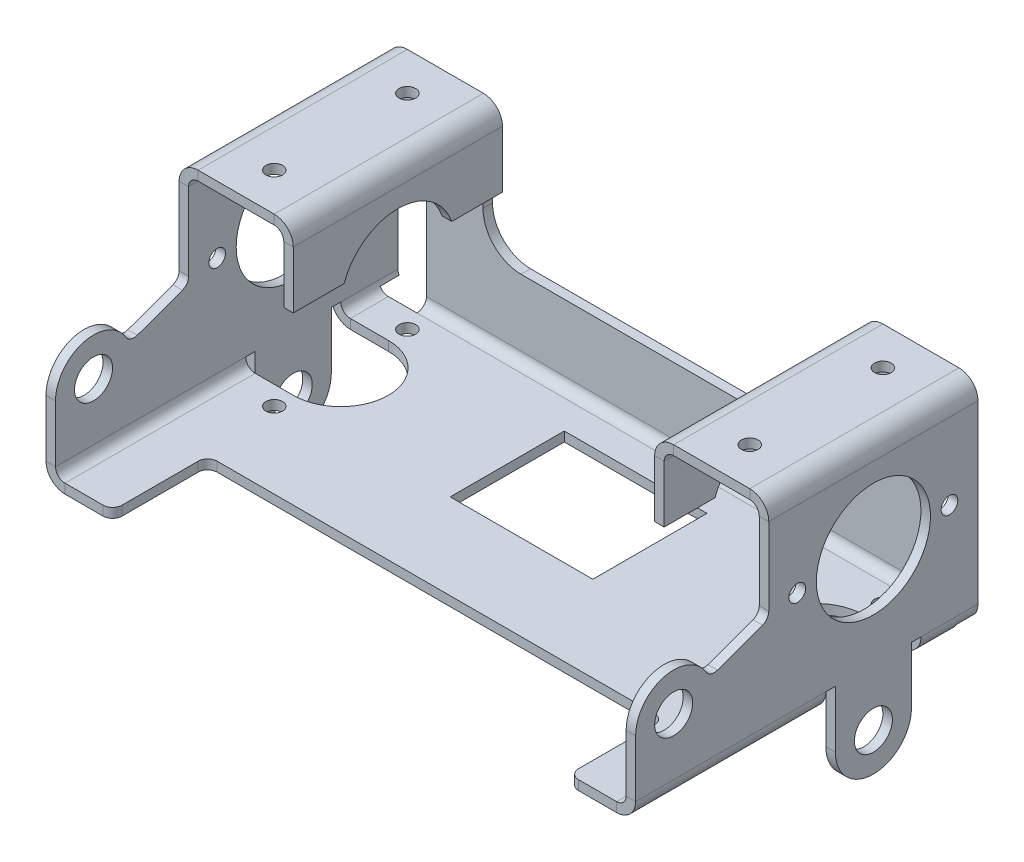
from build123d import *

# Parameters (mm, degrees)
BASE_FLANGE1_DEPTH           = 36
SKETCH6_W                    = 96
SKETCH6_H                    = 20
CUT_EXTRUDE1_DEPTH           = 10
BREAK_CORNER1_DEPTH          = 2
BREAK_CORNER1_2_DEPTH        = 2
SKETCH10_R                   = 4
CUT_EXTRUDE3_DEPTH           = 137.736973785
SKETCH11_W                   = 28
SKETCH11_H                   = 4
CUT_EXTRUDE4_DEPTH           = 137.736973785
SKETCH12_R                   = 12
SKETCH12_R_2                 = 1.75
CUT_EXTRUDE5_DEPTH           = 137.736973785
SKETCH13_W                   = 30
SKETCH13_H                   = 24
CUT_EXTRUDE6_DEPTH           = 84.600239234
CUT_EXTRUDE7_START           = -84.600239234
SKETCH17_W                   = 4
SKETCH17_H                   = 2
SKETCH17_H_2                 = 16
CUT_EXTRUDE7_DEPTH           = 86.600239234
SKETCH24_R                   = 4
TAB1_DEPTH                   = 2
CUT_EXTRUDE9_START           = -36
CUT_EXTRUDE9_DEPTH           = 4
EDGE_FLANGE2_STRIP_W         = 12
EDGE_FLANGE2_STRIP_H         = 2
EDGE_FLANGE2_STRIP_CUT_DEPTH = 106
EDGE_FLANGE2_DEPTH           = 106
EDGE_FLANGE2_FLAT_DEPTH      = 2
SKETCH39_R                   = 1.75
CUT_EXTRUDE10_DEPTH          = 95.132884796


# Read off the part's stored shape, not the designer's step: Break-Corner1, Cut-Extrude9
# Sheet-metal steps are written as plain solids
with BuildPart() as part:
    # Sketch1 → Base-Flange1 (new, symmetric)
    with BuildSketch(Plane.XY):
        with BuildLine():
            Line((-38, 29), (-38, 41))
            ThreePointArc((-38, 41), (-39.171572875, 43.828427125), (-42, 45))
            Line((-42, 45), (-58, 45))
            ThreePointArc((-58, 45), (-60.828427125, 43.828427125), (-62, 41))
            Line((-62, 41), (-62, 4))
            ThreePointArc((-62, 4), (-60.828427125, 1.171572875), (-58, 0))
            Line((-58, 0), (58, 0))
            ThreePointArc((58, 0), (60.828427125, 1.171572875), (62, 4))
            Line((62, 4), (62, 41))
            ThreePointArc((62, 41), (60.828427125, 43.828427125), (58, 45))
            Line((58, 45), (42, 45))
            ThreePointArc((42, 45), (39.171572875, 43.828427125), (38, 41))
            Line((38, 41), (38, 29))
            Line((38, 29), (40, 29))
            Line((40, 29), (40, 41))
            ThreePointArc((40, 41), (40.585786438, 42.414213562), (42, 43))
            Line((42, 43), (58, 43))
            ThreePointArc((58, 43), (59.414213562, 42.414213562), (60, 41))
            Line((60, 41), (60, 4))
            ThreePointArc((60, 4), (59.414213562, 2.585786438), (58, 2))
            Line((58, 2), (-58, 2))
            ThreePointArc((-58, 2), (-59.414213562, 2.585786438), (-60, 4))
            Line((-60, 4), (-60, 41))
            ThreePointArc((-60, 41), (-59.414213562, 42.414213562), (-58, 43))
            Line((-58, 43), (-42, 43))
            ThreePointArc((-42, 43), (-40.585786438, 42.414213562), (-40, 41))
            Line((-40, 41), (-40, 29))
            Line((-40, 29), (-38, 29))
        make_face()
    extrude(amount=BASE_FLANGE1_DEPTH, both=True)

    # Sketch6 → Cut-Extrude1 (cut)
    with BuildSketch(Plane(origin=(0, 2, 0), x_dir=(1, 0, 0), z_dir=(0, 1, 0))):
        with Locations((0, -26)):
            Rectangle(SKETCH6_W, SKETCH6_H)
    extrude(amount=-CUT_EXTRUDE1_DEPTH, mode=Mode.SUBTRACT)

    # Break-Corner1 outline → Break-Corner1 (cut)
    with BuildSketch(Plane(origin=(0, 0, 0), x_dir=(1, 0, 0), z_dir=(0, 1, 0))):
        with BuildLine():
            Line((-48, -36), (-48, -34))
            ThreePointArc((-48, -34), (-48.585786438, -35.414213562), (-50, -36))
            Line((-50, -36), (-48, -36))
        make_face()
        with BuildLine():
            ThreePointArc((50, -36), (48.585786438, -35.414213562), (48, -34))
            Line((48, -34), (48, -36))
            Line((48, -36), (50, -36))
        make_face()
    extrude(amount=BREAK_CORNER1_DEPTH, mode=Mode.SUBTRACT)

    # Break-Corner1 2 outline → Break-Corner1 2 (add)
    with BuildSketch(Plane(origin=(0, 0, 0), x_dir=(1, 0, 0), z_dir=(0, 1, 0))):
        with BuildLine():
            Line((48, -16), (46, -16))
            ThreePointArc((46, -16), (47.414213562, -16.585786438), (48, -18))
            Line((48, -18), (48, -16))
        make_face()
        with BuildLine():
            ThreePointArc((-48, -18), (-47.414213562, -16.585786438), (-46, -16))
            Line((-46, -16), (-48, -16))
            Line((-48, -16), (-48, -18))
        make_face()
    extrude(amount=BREAK_CORNER1_2_DEPTH)

    # Sketch10 → Cut-Extrude3 (cut, through all)
    with BuildSketch(Plane.ZY.offset(62)):
        with BuildLine():
            Line((36, 41), (8, 41))
            Line((8, 41), (8, 24.679819762))
            ThreePointArc((8, 24.679819762), (8.361695911, 23.532666889), (9.315959713, 22.80043452))
            Line((9.315959713, 22.80043452), (18.792930256, 19.351099332))
            ThreePointArc((18.792930256, 19.351099332), (20.135742808, 19.342093961), (21.181576434, 20.184387659))
            ThreePointArc((21.181576434, 20.184387659), (30.174006839, 23.698941113), (36, 16))
            Line((36, 16), (36, 41))
        make_face()
        with Locations((28, 16)):
            Circle(SKETCH10_R)
    extrude(amount=-CUT_EXTRUDE3_DEPTH, mode=Mode.SUBTRACT)

    # Sketch11 → Cut-Extrude4 (cut, through all)
    with BuildSketch(Plane.ZY.offset(62)):
        with Locations((22, 43)):
            Rectangle(SKETCH11_W, SKETCH11_H)
    extrude(amount=-CUT_EXTRUDE4_DEPTH, mode=Mode.SUBTRACT)

    # Sketch12 → Cut-Extrude5 (cut, through all)
    with BuildSketch(Plane.ZY.offset(62)):
        with Locations((-14, 25)):
            Circle(SKETCH12_R)
        with Locations((-30, 25)):
            Circle(SKETCH12_R_2)
        with Locations((2, 25)):
            Circle(SKETCH12_R_2)
    extrude(amount=-CUT_EXTRUDE5_DEPTH, mode=Mode.SUBTRACT)

    # Sketch13 → Cut-Extrude6 (cut, through all)
    with BuildSketch(Plane(origin=(0, 2, 0), x_dir=(1, 0, 0), z_dir=(0, 1, 0))):
        with Locations((0, 14)):
            Rectangle(SKETCH13_W, SKETCH13_H)
    extrude(amount=-CUT_EXTRUDE6_DEPTH, mode=Mode.SUBTRACT)

    # Sketch17 → Cut-Extrude7 (cut)
    with BuildSketch(Plane(origin=(0, 2, 0), x_dir=(1, 0, 0), z_dir=(0, 1, 0)).offset(CUT_EXTRUDE7_START)):
        with BuildLine():
            Line((-58, 24), (-58, 22))
            Line((-58, 22), (-50, 22))
            ThreePointArc((-50, 22), (-42, 14), (-50, 6))
            Line((-50, 6), (-58, 6))
            Line((-58, 6), (-58, 4))
            Line((-58, 4), (-50, 4))
            ThreePointArc((-50, 4), (-40, 14), (-50, 24))
            Line((-50, 24), (-58, 24))
        make_face()
        with Locations((-60, 5)):
            Rectangle(SKETCH17_W, SKETCH17_H)
        with Locations((-60, 23)):
            Rectangle(SKETCH17_W, SKETCH17_H)
        with BuildLine():
            Line((-50, 22), (-58, 22))
            Line((-58, 22), (-58, 6))
            Line((-58, 6), (-50, 6))
            ThreePointArc((-50, 6), (-42, 14), (-50, 22))
        make_face()
        with Locations((-60, 14)):
            Rectangle(SKETCH17_W, SKETCH17_H_2)
    cut_extrude7 = extrude(amount=CUT_EXTRUDE7_DEPTH, mode=Mode.SUBTRACT)

    # Sketch24 → Tab1 (add)
    with BuildSketch(Plane.ZY.offset(62)):
        with BuildLine():
            Line((-22, 4), (-22, -8))
            ThreePointArc((-22, -8), (-14, -16), (-6, -8))
            Line((-6, -8), (-6, 4))
            Line((-6, 4), (-22, 4))
        make_face()
        with Locations((-14, -8)):
            Circle(SKETCH24_R, mode=Mode.SUBTRACT)
    tab1 = extrude(amount=-TAB1_DEPTH)

    # Mirror1: Cut-Extrude7, Tab1 across plane
    add(cut_extrude7.mirror(Plane(origin=(0, 0, 0), x_dir=(0, 0, 1), z_dir=(1, 0, 0))), mode=Mode.SUBTRACT)
    add(tab1.mirror(Plane(origin=(0, 0, 0), x_dir=(0, 0, 1), z_dir=(1, 0, 0))))

    # Cut-Extrude9 outline → Cut-Extrude9 (cut)
    with BuildSketch(Plane.XY.offset(CUT_EXTRUDE9_START)):
        with BuildLine():
            Line((61.464101615, 2), (59.732050807, 3))
            ThreePointArc((59.732050807, 3), (59, 2.267949193), (58, 2))
            Line((58, 2), (52, 2))
            Line((52, 2), (52, 0))
            Line((52, 0), (58, 0))
            ThreePointArc((58, 0), (60, 0.535898385), (61.464101615, 2))
        make_face()
        with BuildLine():
            Line((-52, 0), (-52, 2))
            Line((-52, 2), (-58, 2))
            ThreePointArc((-58, 2), (-59, 2.267949193), (-59.732050807, 3))
            Line((-59.732050807, 3), (-61.464101615, 2))
            ThreePointArc((-61.464101615, 2), (-60, 0.535898385), (-58, 0))
            Line((-58, 0), (-52, 0))
        make_face()
    extrude(amount=CUT_EXTRUDE9_DEPTH, mode=Mode.SUBTRACT)

    # Edge-Flange2 strip (across the edge) → Edge-Flange2 strip cut (cut)
    with BuildSketch(Plane(origin=(54, 2, -36), x_dir=(0, 0, 1), z_dir=(-1, 0, 0))):
        with Locations((-2, -1)):
            Rectangle(EDGE_FLANGE2_STRIP_W, EDGE_FLANGE2_STRIP_H)
    extrude(amount=EDGE_FLANGE2_STRIP_CUT_DEPTH, mode=Mode.SUBTRACT)

    # Edge-Flange2 bend section (across the edge) → Edge-Flange2 (add)
    with BuildSketch(Plane(origin=(54, 2, -36), x_dir=(0, 0, 1), z_dir=(-1, 0, 0))):
        with BuildLine():
            Line((0, 2), (2, 2))
            ThreePointArc((2, 2), (2.585786438, 0.585786438), (4, 0))
            Line((4, 0), (4, -2))
            ThreePointArc((4, -2), (1.171572875, -0.828427125), (0, 2))
        make_face()
    extrude(amount=EDGE_FLANGE2_DEPTH)

    # Edge-Flange2 profile (on flange) → Edge-Flange2 flat (add)
    with BuildSketch(Plane(origin=(0, 2, -36), x_dir=(1, 0, 0), z_dir=(0, 0, 1))):
        with BuildLine():
            Line((-52, 32), (-52, 2))
            Line((-52, 2), (54, 2))
            Line((54, 2), (54, 32))
            Line((54, 32), (59.9, 32))
            Line((59.9, 32), (59.9, 39))
            ThreePointArc((59.9, 39), (59.343502884, 40.343502884), (58, 40.9))
            Line((58, 40.9), (42, 40.9))
            ThreePointArc((42, 40.9), (40.656497116, 40.343502884), (40.1, 39))
            Line((40.1, 39), (40.1, 27))
            Line((40.1, 27), (40.1, 24))
            ThreePointArc((40.1, 24), (37.756854249, 18.343145751), (32.1, 16))
            Line((32.1, 16), (-32.1, 16))
            ThreePointArc((-32.1, 16), (-37.756854249, 18.343145751), (-40.1, 24))
            Line((-40.1, 24), (-40.1, 27))
            Line((-40.1, 27), (-40.1, 39))
            ThreePointArc((-40.1, 39), (-40.656497116, 40.343502884), (-42, 40.9))
            Line((-42, 40.9), (-58, 40.9))
            ThreePointArc((-58, 40.9), (-59.343502884, 40.343502884), (-59.9, 39))
            Line((-59.9, 39), (-59.9, 32))
            Line((-59.9, 32), (-54, 32))
            Line((-54, 32), (-52, 32))
        make_face()
    extrude(amount=EDGE_FLANGE2_FLAT_DEPTH)

    # Sketch39 → Cut-Extrude10 (cut, through all)
    with BuildSketch(Plane(origin=(0, 45, 0), x_dir=(1, 0, 0), z_dir=(0, 1, 0))):
        with Locations(Location((-50, 28, 0), (0, 0, 270))):
            Circle(SKETCH39_R)
        with Locations(Location((-50, 0, 0), (0, 0, 270))):
            Circle(SKETCH39_R)
        with Locations(Location((50, 0, 0), (0, 0, 270))):
            Circle(SKETCH39_R)
        with Locations(Location((50, 28, 0), (0, 0, 270))):
            Circle(SKETCH39_R)
    extrude(amount=-CUT_EXTRUDE10_DEPTH, mode=Mode.SUBTRACT)


solid = part.part
